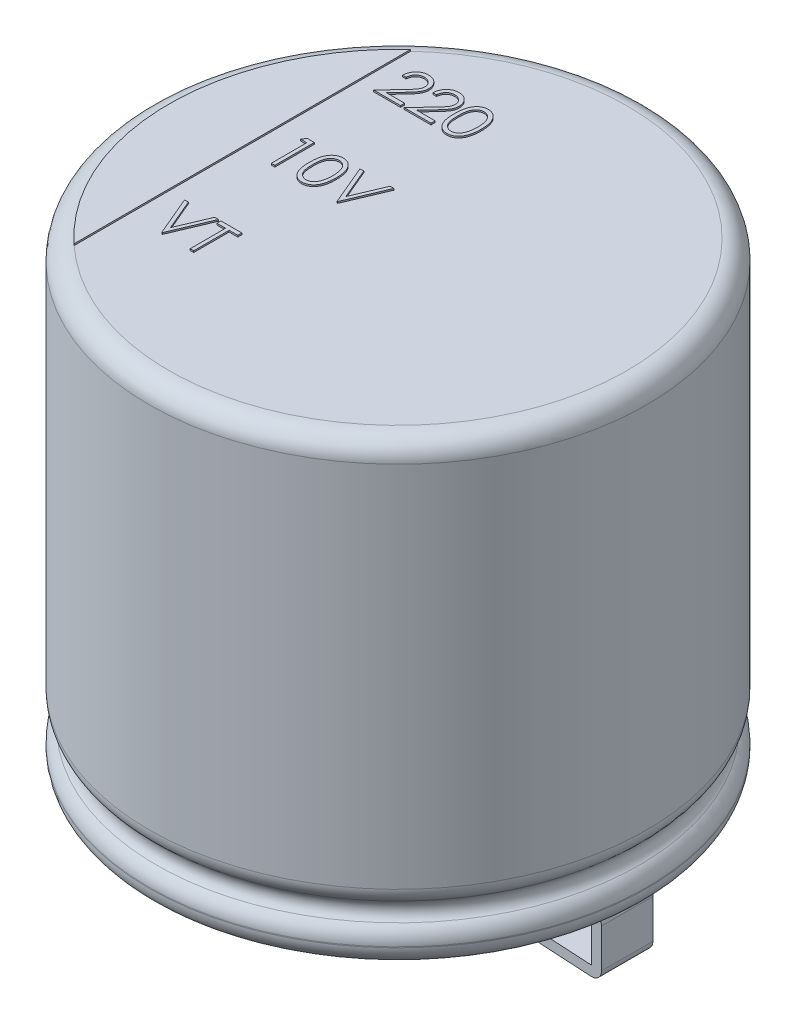
from build123d import *

# Parameters (mm, degrees)
LABELING_START      = 2.9
LABELING_TEXT_DEPTH = 0.02
TAB_DEPTH           = 0.325
TAB_2_DEPTH         = 0.325
CUT_EXTRUDE1_DEPTH  = 8.329215676


# Read off the part's stored shape, not the designer's step: Labeling Text
with BuildPart() as part:
    # Sketch1 → Cap Body (revolve)
    with BuildSketch(Plane(origin=(0, 0, 0), x_dir=(0, 0, -1), z_dir=(1, 0, 0))):
        with BuildLine():
            Line((0, 2.9), (0, -2.9))
            Line((0, -2.9), (2.9, -2.9))
            ThreePointArc((2.9, -2.9), (3.076776695, -2.826776695), (3.15, -2.65))
            Line((3.15, -2.65), (3.15, -2.638280347))
            ThreePointArc((3.15, -2.638280347), (3.125108719, -2.529532636), (3.055391484, -2.442439884))
            ThreePointArc((3.055391484, -2.442439884), (2.997790055, -2.32320442), (3.055391484, -2.203968956))
            ThreePointArc((3.055391484, -2.203968956), (3.125108719, -2.116876204), (3.15, -2.008128493))
            Line((3.15, -2.008128493), (3.15, 2.65))
            ThreePointArc((3.15, 2.65), (3.076776695, 2.826776695), (2.9, 2.9))
            Line((2.9, 2.9), (0, 2.9))
        make_face()
    revolve(axis=Axis((0, -4.584100675, 0), (0, 1, 0)))

    # Labeling Text outline → Labeling Text (add)
    # profile 1 of 9: a face of its own
    with BuildSketch(Plane(origin=(0, 0, 0), x_dir=(1, 0, 0), z_dir=(0, 1, 0)).offset(LABELING_START)):
        with BuildLine():
            add(Edge.make_bspline(
                [(-1.577067817, 1.911538462), (-1.580977936, 1.911436314), (-1.588656764, 1.911235713), (-1.599930912, 1.909832476), (-1.610686023, 1.907411641), (-1.620949152, 1.904100688), (-1.630737664, 1.899892324), (-1.640003956, 1.894650646), (-1.648727226, 1.888395861), (-1.656923872, 1.881304353), (-1.664475869, 1.873408981), (-1.671111137, 1.864607558), (-1.676908853, 1.855060785), (-1.681967315, 1.84479442), (-1.686075271, 1.833715309), (-1.689214293, 1.821862779), (-1.691698128, 1.809288296), (-1.692527916, 1.800604713), (-1.692953234, 1.796153846)],
                knots=[0, 0, 0, 0, 0.064438672, 0.126546911, 0.186887153, 0.245877536, 0.304040885, 0.362191218, 0.420975933, 0.480660283, 0.540600275, 0.600689098, 0.66193579, 0.724442506, 0.789038394, 0.856313757, 0.926352028, 1, 1, 1, 1], degree=3))
            add(Edge.make_bspline(
                [(-1.468594259, 1.810176282), (-1.46868508, 1.81358791), (-1.468864069, 1.820311575), (-1.47044374, 1.83016954), (-1.472830955, 1.839678799), (-1.476251707, 1.848868602), (-1.480766955, 1.857646552), (-1.486263152, 1.866023335), (-1.49260459, 1.874121759), (-1.499940485, 1.881715087), (-1.507999274, 1.888669545), (-1.516512738, 1.894830129), (-1.525519896, 1.899978573), (-1.534982771, 1.904199073), (-1.544874981, 1.907509842), (-1.555215658, 1.909803924), (-1.565976232, 1.911244279), (-1.573323874, 1.911439161), (-1.577067817, 1.911538462)],
                knots=[0, 0, 0, 0, 0.061965401, 0.122121906, 0.180988497, 0.239933216, 0.299905831, 0.359988847, 0.421775742, 0.486575826, 0.551534805, 0.615017543, 0.677258617, 0.739729962, 0.803050103, 0.866495132, 0.931973474, 1, 1, 1, 1], degree=3))
            add(Edge.make_bspline(
                [(-1.563145541, 1.65693109), (-1.558424415, 1.661859419), (-1.549356097, 1.671325732), (-1.536530014, 1.685146154), (-1.525010159, 1.697967517), (-1.51472196, 1.709765596), (-1.505888602, 1.720712963), (-1.498049712, 1.730455063), (-1.491768913, 1.739419985), (-1.484952428, 1.749811501), (-1.47835043, 1.762498975), (-1.472677237, 1.778003788), (-1.469217973, 1.793964824), (-1.468802996, 1.804750829), (-1.468594259, 1.810176282)],
                knots=[0, 0, 0, 0, 0.110802644, 0.212829202, 0.30610131, 0.390647321, 0.466924469, 0.534481039, 0.593586941, 0.644557005, 0.736200453, 0.825024026, 0.911985585, 1, 1, 1, 1], degree=3))
            Line((-1.563145541, 1.65693109), (-1.757055798, 1.45))
            Line((-1.757055798, 1.45), (-1.417312208, 1.45))
            Line((-1.417312208, 1.45), (-1.417312208, 1.501282051))
            Line((-1.417312208, 1.501282051), (-1.649984484, 1.501282051))
            Line((-1.649984484, 1.501282051), (-1.524884324, 1.634795673))
            add(Edge.make_bspline(
                [(-1.423722465, 1.814182692), (-1.423964359, 1.807218716), (-1.424443904, 1.793412971), (-1.428545957, 1.773125134), (-1.434952602, 1.753468931), (-1.44266651, 1.737649316), (-1.450448288, 1.724901674), (-1.457460789, 1.714406145), (-1.465670048, 1.703105364), (-1.475195547, 1.691037173), (-1.485840243, 1.678107043), (-1.497700552, 1.664322787), (-1.51086105, 1.64982682), (-1.520097978, 1.63992602), (-1.524884324, 1.634795673)],
                knots=[0, 0, 0, 0, 0.098702196, 0.195672309, 0.292422427, 0.391342544, 0.444462441, 0.504228775, 0.570352338, 0.642545753, 0.722287505, 0.807921123, 0.900469538, 1, 1, 1, 1], degree=3))
            add(Edge.make_bspline(
                [(-1.574764131, 1.962820513), (-1.569281549, 1.962692162), (-1.558508471, 1.962439957), (-1.542785326, 1.960274096), (-1.527817142, 1.956881868), (-1.513633175, 1.952122523), (-1.500346594, 1.945724748), (-1.487857588, 1.938039385), (-1.476017472, 1.929150838), (-1.46535936, 1.918686007), (-1.455572492, 1.907514238), (-1.447129312, 1.895587395), (-1.43989886, 1.883268925), (-1.433872049, 1.870464896), (-1.429435458, 1.85705475), (-1.426067142, 1.843233721), (-1.424163226, 1.828858748), (-1.423871023, 1.81912924), (-1.423722465, 1.814182692)],
                knots=[0, 0, 0, 0, 0.06947546, 0.136516798, 0.200788824, 0.263829673, 0.325735023, 0.387290692, 0.449509219, 0.51296782, 0.576275215, 0.6375801, 0.697902606, 0.757172088, 0.816598528, 0.876653171, 0.937289642, 1, 1, 1, 1], degree=3))
            add(Edge.make_bspline(
                [(-1.737825029, 1.796153846), (-1.737532578, 1.80210683), (-1.736958213, 1.813798332), (-1.734268458, 1.830844605), (-1.730419761, 1.847138147), (-1.724978125, 1.862548135), (-1.718220085, 1.877210822), (-1.710115795, 1.891067967), (-1.700516674, 1.904066708), (-1.689629998, 1.916086543), (-1.677805906, 1.927113339), (-1.665047915, 1.936635516), (-1.651641482, 1.944680898), (-1.637627283, 1.951406789), (-1.622847202, 1.956455339), (-1.607435365, 1.960201287), (-1.59132406, 1.962455051), (-1.580346914, 1.962697306), (-1.574764131, 1.962820513)],
                knots=[0, 0, 0, 0, 0.068790794, 0.135103289, 0.198978674, 0.2619043, 0.323494969, 0.385195378, 0.446969239, 0.509764777, 0.572250569, 0.633405176, 0.693251163, 0.752583163, 0.812579266, 0.873275085, 0.935549943, 1, 1, 1, 1], degree=3))
            Line((-1.737825029, 1.796153846), (-1.692953234, 1.796153846))
        make_face()
    # profile 2 of 9: a face of its own
    with BuildSketch(Plane(origin=(0, 0, 0), x_dir=(1, 0, 0), z_dir=(0, 1, 0)).offset(LABELING_START)):
        with BuildLine():
            add(Edge.make_bspline(
                [(-1.192452432, 1.911538462), (-1.196362551, 1.911436314), (-1.204041379, 1.911235713), (-1.215315527, 1.909832476), (-1.226070638, 1.907411641), (-1.236333767, 1.904100688), (-1.246122279, 1.899892324), (-1.255388571, 1.894650646), (-1.264111841, 1.888395861), (-1.272308487, 1.881304353), (-1.279860484, 1.873408981), (-1.286495752, 1.864607558), (-1.292293469, 1.855060785), (-1.297351931, 1.84479442), (-1.301459886, 1.833715309), (-1.304598908, 1.821862779), (-1.307082743, 1.809288296), (-1.307912532, 1.800604713), (-1.308337849, 1.796153846)],
                knots=[0, 0, 0, 0, 0.064438672, 0.126546911, 0.186887153, 0.245877536, 0.304040885, 0.362191218, 0.420975933, 0.480660283, 0.540600275, 0.600689098, 0.66193579, 0.724442506, 0.789038394, 0.856313757, 0.926352028, 1, 1, 1, 1], degree=3))
            add(Edge.make_bspline(
                [(-1.083978875, 1.810176282), (-1.084069695, 1.81358791), (-1.084248685, 1.820311575), (-1.085828356, 1.83016954), (-1.088215571, 1.839678799), (-1.091636322, 1.848868602), (-1.096151571, 1.857646552), (-1.101647768, 1.866023335), (-1.107989205, 1.874121759), (-1.115325101, 1.881715087), (-1.123383889, 1.888669545), (-1.131897354, 1.894830129), (-1.140904511, 1.899978573), (-1.150367386, 1.904199073), (-1.160259596, 1.907509842), (-1.170600274, 1.909803924), (-1.181360848, 1.911244279), (-1.18870849, 1.911439161), (-1.192452432, 1.911538462)],
                knots=[0, 0, 0, 0, 0.061965401, 0.122121906, 0.180988497, 0.239933216, 0.299905831, 0.359988847, 0.421775742, 0.486575826, 0.551534805, 0.615017543, 0.677258617, 0.739729962, 0.803050103, 0.866495132, 0.931973474, 1, 1, 1, 1], degree=3))
            add(Edge.make_bspline(
                [(-1.178530157, 1.65693109), (-1.17380903, 1.661859419), (-1.164740712, 1.671325732), (-1.15191463, 1.685146154), (-1.140394774, 1.697967517), (-1.130106575, 1.709765596), (-1.121273217, 1.720712963), (-1.113434327, 1.730455063), (-1.107153528, 1.739419985), (-1.100337043, 1.749811501), (-1.093735046, 1.762498975), (-1.088061852, 1.778003788), (-1.084602588, 1.793964824), (-1.084187612, 1.804750829), (-1.083978875, 1.810176282)],
                knots=[0, 0, 0, 0, 0.110802644, 0.212829202, 0.30610131, 0.390647321, 0.466924469, 0.534481039, 0.593586941, 0.644557005, 0.736200453, 0.825024026, 0.911985585, 1, 1, 1, 1], degree=3))
            Line((-1.178530157, 1.65693109), (-1.372440413, 1.45))
            Line((-1.372440413, 1.45), (-1.032696824, 1.45))
            Line((-1.032696824, 1.45), (-1.032696824, 1.501282051))
            Line((-1.032696824, 1.501282051), (-1.265369099, 1.501282051))
            Line((-1.265369099, 1.501282051), (-1.140268939, 1.634795673))
            add(Edge.make_bspline(
                [(-1.03910708, 1.814182692), (-1.039348975, 1.807218716), (-1.039828519, 1.793412971), (-1.043930573, 1.773125134), (-1.050337217, 1.753468931), (-1.058051125, 1.737649316), (-1.065832903, 1.724901674), (-1.072845404, 1.714406145), (-1.081054663, 1.703105364), (-1.090580163, 1.691037173), (-1.101224859, 1.678107043), (-1.113085168, 1.664322787), (-1.126245665, 1.64982682), (-1.135482594, 1.63992602), (-1.140268939, 1.634795673)],
                knots=[0, 0, 0, 0, 0.098702196, 0.195672309, 0.292422427, 0.391342544, 0.444462441, 0.504228775, 0.570352338, 0.642545753, 0.722287505, 0.807921123, 0.900469538, 1, 1, 1, 1], degree=3))
            add(Edge.make_bspline(
                [(-1.190148747, 1.962820513), (-1.184666165, 1.962692162), (-1.173893087, 1.962439957), (-1.158169942, 1.960274096), (-1.143201757, 1.956881868), (-1.12901779, 1.952122523), (-1.11573121, 1.945724748), (-1.103242203, 1.938039385), (-1.091402087, 1.929150838), (-1.080743975, 1.918686007), (-1.070957107, 1.907514238), (-1.062513928, 1.895587395), (-1.055283476, 1.883268925), (-1.049256664, 1.870464896), (-1.044820073, 1.85705475), (-1.041451758, 1.843233721), (-1.039547841, 1.828858748), (-1.039255638, 1.81912924), (-1.03910708, 1.814182692)],
                knots=[0, 0, 0, 0, 0.06947546, 0.136516798, 0.200788824, 0.263829673, 0.325735023, 0.387290692, 0.449509219, 0.51296782, 0.576275215, 0.6375801, 0.697902606, 0.757172088, 0.816598528, 0.876653171, 0.937289642, 1, 1, 1, 1], degree=3))
            add(Edge.make_bspline(
                [(-1.353209644, 1.796153846), (-1.352917194, 1.80210683), (-1.352342829, 1.813798332), (-1.349653073, 1.830844605), (-1.345804376, 1.847138147), (-1.34036274, 1.862548135), (-1.3336047, 1.877210822), (-1.325500411, 1.891067967), (-1.315901289, 1.904066708), (-1.305014613, 1.916086543), (-1.293190522, 1.927113339), (-1.28043253, 1.936635516), (-1.267026098, 1.944680898), (-1.253011898, 1.951406789), (-1.238231818, 1.956455339), (-1.222819981, 1.960201287), (-1.206708675, 1.962455051), (-1.195731529, 1.962697306), (-1.190148747, 1.962820513)],
                knots=[0, 0, 0, 0, 0.068790794, 0.135103289, 0.198978674, 0.2619043, 0.323494969, 0.385195378, 0.446969239, 0.509764777, 0.572250569, 0.633405176, 0.693251163, 0.752583163, 0.812579266, 0.873275085, 0.935549943, 1, 1, 1, 1], degree=3))
            Line((-1.353209644, 1.796153846), (-1.308337849, 1.796153846))
        make_face()
    # profile 3 of 9: a face of its own
    with BuildSketch(Plane(origin=(0, 0, 0), x_dir=(1, 0, 0), z_dir=(0, 1, 0)).offset(LABELING_START)):
        with BuildLine():
            add(Edge.make_bspline(
                [(-0.820657561, 1.437179487), (-0.824601006, 1.437246109), (-0.832376709, 1.437377475), (-0.843898484, 1.43873658), (-0.85508169, 1.440921652), (-0.865981512, 1.443981167), (-0.876653872, 1.447726143), (-0.886953341, 1.452605241), (-0.896994439, 1.458224394), (-0.906750375, 1.46462374), (-0.916037827, 1.471955409), (-0.924909056, 1.480064593), (-0.933141202, 1.489153651), (-0.940803216, 1.499079069), (-0.948085228, 1.509749532), (-0.95478371, 1.521310728), (-0.960979546, 1.533716816), (-0.966642902, 1.547047946), (-0.97166414, 1.56149865), (-0.976099527, 1.577234247), (-0.979601549, 1.594393623), (-0.982599114, 1.612838961), (-0.985016883, 1.632649523), (-0.986667501, 1.653836063), (-0.987687689, 1.676385378), (-0.987778413, 1.691852489), (-0.987825029, 1.699799679)],
                knots=[0, 0, 0, 0, 0.033787146, 0.066621658, 0.099284878, 0.131361165, 0.163585188, 0.196103927, 0.228902254, 0.262158056, 0.295991222, 0.330217846, 0.365059826, 0.400950737, 0.437620382, 0.475707529, 0.515380692, 0.556413541, 0.59976483, 0.646424156, 0.696431445, 0.749781518, 0.806573307, 0.867435532, 0.931886753, 1, 1, 1, 1], degree=3))
            add(Edge.make_bspline(
                [(-0.648081439, 1.699799679), (-0.648174522, 1.692153407), (-0.648355892, 1.677254957), (-0.649295707, 1.655464817), (-0.65114694, 1.634893668), (-0.653462653, 1.615492174), (-0.656669933, 1.597341085), (-0.660613528, 1.580377593), (-0.664992146, 1.56452844), (-0.670397116, 1.549923466), (-0.676312932, 1.536358935), (-0.682749389, 1.523692199), (-0.689645078, 1.5118113), (-0.697157756, 1.500811336), (-0.705165387, 1.490614385), (-0.713839356, 1.481400439), (-0.722935154, 1.472947486), (-0.732565499, 1.465425825), (-0.742624292, 1.458842281), (-0.752904161, 1.452954589), (-0.763587501, 1.448207061), (-0.774432209, 1.444130626), (-0.785593404, 1.441016276), (-0.797057174, 1.438862868), (-0.808765208, 1.437352604), (-0.816679717, 1.437237393), (-0.820657561, 1.437179487)],
                knots=[0, 0, 0, 0, 0.06506329, 0.126773166, 0.185515763, 0.240764679, 0.292979796, 0.342250373, 0.388919286, 0.432775664, 0.474628433, 0.514774691, 0.553605893, 0.591426406, 0.62802812, 0.663803634, 0.698984336, 0.733591489, 0.767628469, 0.801208348, 0.83426384, 0.866980695, 0.899719742, 0.932701912, 0.966175883, 1, 1, 1, 1], degree=3))
            add(Edge.make_bspline(
                [(-0.820657561, 1.962820513), (-0.816681064, 1.962750825), (-0.808773062, 1.962612238), (-0.79708158, 1.961280246), (-0.785660197, 1.959070085), (-0.774557606, 1.955938518), (-0.763682608, 1.952053421), (-0.753120264, 1.947183833), (-0.742804967, 1.941515423), (-0.73290064, 1.934854869), (-0.723298552, 1.92742883), (-0.714234557, 1.919034163), (-0.705707831, 1.909755632), (-0.697611358, 1.899692508), (-0.690174845, 1.888651782), (-0.683092926, 1.87682548), (-0.676754063, 1.864006785), (-0.67064911, 1.850409576), (-0.66537954, 1.835657624), (-0.660627219, 1.819834087), (-0.656787367, 1.80275206), (-0.653588899, 1.784501168), (-0.651111057, 1.765014385), (-0.649306394, 1.744333483), (-0.648353096, 1.722444856), (-0.648173567, 1.707479449), (-0.648081439, 1.699799679)],
                knots=[0, 0, 0, 0, 0.033788116, 0.067193932, 0.099862411, 0.132566612, 0.165151173, 0.197913187, 0.231319004, 0.265083278, 0.299255309, 0.334398567, 0.369942824, 0.406283561, 0.44406382, 0.482997707, 0.523354447, 0.56553659, 0.609612924, 0.656390811, 0.705885495, 0.7583245, 0.813831783, 0.872794559, 0.93472223, 1, 1, 1, 1], degree=3))
            add(Edge.make_bspline(
                [(-0.987825029, 1.699799679), (-0.987778169, 1.707813592), (-0.987687143, 1.723380733), (-0.986674512, 1.746064253), (-0.98499232, 1.767344294), (-0.982686981, 1.787221875), (-0.979881555, 1.805702127), (-0.976136486, 1.822735664), (-0.971877514, 1.838401322), (-0.96694145, 1.852750186), (-0.961371766, 1.865975572), (-0.955309729, 1.87832203), (-0.948514758, 1.889770877), (-0.941375199, 1.900504847), (-0.933602046, 1.910348232), (-0.925416505, 1.919440041), (-0.916499094, 1.927570148), (-0.90715295, 1.934976763), (-0.897293455, 1.941469544), (-0.887201645, 1.947188507), (-0.876808059, 1.952074202), (-0.866084318, 1.955915693), (-0.85512681, 1.959088671), (-0.843897229, 1.961258521), (-0.832377034, 1.962623794), (-0.824601115, 1.962754318), (-0.820657561, 1.962820513)],
                knots=[0, 0, 0, 0, 0.068594622, 0.133246042, 0.194312586, 0.251279223, 0.304513439, 0.354234907, 0.400480589, 0.443410755, 0.484014869, 0.523252301, 0.561042373, 0.597900239, 0.633518489, 0.668314351, 0.702495671, 0.736685354, 0.770293169, 0.803437255, 0.835912952, 0.868460246, 0.900846538, 0.933466525, 0.966257575, 1, 1, 1, 1], degree=3))
        make_face()
        with BuildLine():
            add(Edge.make_bspline(
                [(-0.819155157, 1.911538462), (-0.824685241, 1.911248255), (-0.835755485, 1.910667313), (-0.852105193, 1.906568277), (-0.867777243, 1.899423567), (-0.880240525, 1.891573228), (-0.889792495, 1.884096327), (-0.896518594, 1.877612548), (-0.90282519, 1.870520225), (-0.908634861, 1.862748523), (-0.914076187, 1.854396328), (-0.919073475, 1.845397933), (-0.923575951, 1.835707738), (-0.927730884, 1.825333962), (-0.93138414, 1.813965255), (-0.934397563, 1.801426828), (-0.937181428, 1.787646557), (-0.939152181, 1.772543771), (-0.940904146, 1.756217749), (-0.942030052, 1.738606703), (-0.942905946, 1.719740363), (-0.942937156, 1.706711912), (-0.942953234, 1.7)],
                knots=[0, 0, 0, 0, 0.060386619, 0.120883249, 0.182754619, 0.24781103, 0.2812991, 0.315087624, 0.349702396, 0.384856581, 0.420966197, 0.458511188, 0.497174722, 0.537602048, 0.580503018, 0.62746754, 0.67838821, 0.733983221, 0.793746705, 0.857713672, 0.926697864, 1, 1, 1, 1], degree=3))
            add(Edge.make_bspline(
                [(-0.692953234, 1.7), (-0.693031832, 1.706009653), (-0.693185588, 1.71776582), (-0.6937733, 1.734982703), (-0.695290954, 1.75133524), (-0.696976542, 1.766893879), (-0.699461859, 1.781572493), (-0.702141546, 1.795493966), (-0.705741719, 1.808485826), (-0.709587401, 1.820751481), (-0.713988886, 1.832151574), (-0.718833991, 1.842739258), (-0.724008528, 1.852565647), (-0.729628848, 1.861603782), (-0.735628232, 1.869894145), (-0.742165024, 1.877270516), (-0.748979935, 1.883961511), (-0.758525247, 1.891599021), (-0.771021574, 1.899386406), (-0.786570952, 1.906552943), (-0.802752473, 1.910668414), (-0.813691538, 1.911248655), (-0.819155157, 1.911538462)],
                knots=[0, 0, 0, 0, 0.065681198, 0.128486464, 0.18817513, 0.245106131, 0.299448425, 0.350822936, 0.399941681, 0.446671744, 0.491254533, 0.533376344, 0.573852755, 0.612526312, 0.649597136, 0.685532042, 0.720105786, 0.753837663, 0.818925416, 0.880493462, 0.940311334, 1, 1, 1, 1], degree=3))
            add(Edge.make_bspline(
                [(-0.711883522, 1.574298878), (-0.710376127, 1.57876027), (-0.707315468, 1.587818807), (-0.703370929, 1.601870758), (-0.700264443, 1.61661401), (-0.697469676, 1.631960455), (-0.695562097, 1.648023269), (-0.694026695, 1.664752753), (-0.693122311, 1.682161519), (-0.693010204, 1.693989375), (-0.692953234, 1.7)],
                knots=[0, 0, 0, 0, 0.110588339, 0.224541754, 0.342503494, 0.464324098, 0.590756033, 0.722227475, 0.858842836, 1, 1, 1, 1], degree=3))
            add(Edge.make_bspline(
                [(-0.819155157, 1.488461538), (-0.813618347, 1.488689793), (-0.802556158, 1.48914583), (-0.786394187, 1.49354565), (-0.770704148, 1.500184156), (-0.758408157, 1.508033799), (-0.749053508, 1.515509275), (-0.742351081, 1.521882796), (-0.736199359, 1.529019349), (-0.730364777, 1.536719248), (-0.725013481, 1.545129603), (-0.720147318, 1.554209971), (-0.71570684, 1.563985568), (-0.713176976, 1.570809816), (-0.711883522, 1.574298878)],
                knots=[0, 0, 0, 0, 0.112813401, 0.225393884, 0.339594815, 0.45967541, 0.52173519, 0.583925839, 0.648174145, 0.713881038, 0.781004455, 0.851450928, 0.924050693, 1, 1, 1, 1], degree=3))
            add(Edge.make_bspline(
                [(-0.942953234, 1.7), (-0.94293617, 1.693321614), (-0.942903052, 1.680360179), (-0.942037881, 1.661525428), (-0.940859276, 1.643958238), (-0.939339091, 1.627636304), (-0.937081527, 1.612614874), (-0.934551986, 1.598790634), (-0.931473687, 1.586236742), (-0.927831542, 1.574867055), (-0.923683099, 1.564488617), (-0.91915369, 1.5548313), (-0.914287873, 1.545781024), (-0.90884228, 1.53741908), (-0.902911556, 1.529718199), (-0.896629662, 1.52254208), (-0.88976215, 1.516142512), (-0.880261616, 1.508467247), (-0.867719262, 1.500535942), (-0.85191634, 1.493629357), (-0.83567799, 1.489289007), (-0.824656383, 1.488737041), (-0.819155157, 1.488461538)],
                knots=[0, 0, 0, 0, 0.072951066, 0.141583694, 0.20592646, 0.265301357, 0.320597233, 0.371816503, 0.41878977, 0.461698729, 0.502133582, 0.540804315, 0.578180525, 0.614296865, 0.649678243, 0.68429946, 0.718358953, 0.752080865, 0.817652439, 0.879722076, 0.93996556, 1, 1, 1, 1], degree=3))
        make_face(mode=Mode.SUBTRACT)
    # profile 4 of 9: a face of its own
    with BuildSketch(Plane(origin=(0, 0, 0), x_dir=(1, 0, 0), z_dir=(0, 1, 0)).offset(LABELING_START)):
        with BuildLine():
            add(Edge.make_bspline(
                [(-1.205272945, -0.012820513), (-1.20921639, -0.012753891), (-1.216992094, -0.012622525), (-1.228513869, -0.01126342), (-1.239697075, -0.009078348), (-1.250596897, -0.006018833), (-1.261269256, -0.002273857), (-1.271568726, 0.002605241), (-1.281609823, 0.008224394), (-1.29136576, 0.01462374), (-1.300653212, 0.021955409), (-1.309524441, 0.030064593), (-1.317756587, 0.039153651), (-1.3254186, 0.049079069), (-1.332700613, 0.059749532), (-1.339399095, 0.071310728), (-1.345594931, 0.083716816), (-1.351258287, 0.097047946), (-1.356279524, 0.11149865), (-1.360714911, 0.127234247), (-1.364216934, 0.144393623), (-1.367214499, 0.162838961), (-1.369632268, 0.182649523), (-1.371282886, 0.203836063), (-1.372303074, 0.226385378), (-1.372393798, 0.241852489), (-1.372440413, 0.249799679)],
                knots=[0, 0, 0, 0, 0.033787146, 0.066621658, 0.099284878, 0.131361165, 0.163585188, 0.196103927, 0.228902254, 0.262158056, 0.295991222, 0.330217846, 0.365059826, 0.400950737, 0.437620382, 0.475707529, 0.515380692, 0.556413541, 0.59976483, 0.646424156, 0.696431445, 0.749781518, 0.806573307, 0.867435532, 0.931886753, 1, 1, 1, 1], degree=3))
            add(Edge.make_bspline(
                [(-1.032696824, 0.249799679), (-1.032789907, 0.242153407), (-1.032971276, 0.227254957), (-1.033911092, 0.205464817), (-1.035762325, 0.184893668), (-1.038078037, 0.165492174), (-1.041285318, 0.147341085), (-1.045228913, 0.130377593), (-1.04960753, 0.11452844), (-1.055012501, 0.099923466), (-1.060928317, 0.086358935), (-1.067364773, 0.073692199), (-1.074260463, 0.0618113), (-1.081773141, 0.050811336), (-1.089780771, 0.040614385), (-1.098454741, 0.031400439), (-1.107550539, 0.022947486), (-1.117180884, 0.015425825), (-1.127239677, 0.008842281), (-1.137519545, 0.002954589), (-1.148202886, -0.001792939), (-1.159047593, -0.005869374), (-1.170208788, -0.008983724), (-1.181672558, -0.011137132), (-1.193380592, -0.012647396), (-1.201295101, -0.012762607), (-1.205272945, -0.012820513)],
                knots=[0, 0, 0, 0, 0.06506329, 0.126773166, 0.185515763, 0.240764679, 0.292979796, 0.342250373, 0.388919286, 0.432775664, 0.474628433, 0.514774691, 0.553605893, 0.591426406, 0.62802812, 0.663803634, 0.698984336, 0.733591489, 0.767628469, 0.801208348, 0.83426384, 0.866980695, 0.899719742, 0.932701912, 0.966175883, 1, 1, 1, 1], degree=3))
            add(Edge.make_bspline(
                [(-1.205272945, 0.512820513), (-1.201296448, 0.512750825), (-1.193388447, 0.512612238), (-1.181696965, 0.511280246), (-1.170275582, 0.509070085), (-1.159172991, 0.505938518), (-1.148297993, 0.502053421), (-1.137735649, 0.497183833), (-1.127420351, 0.491515423), (-1.117516024, 0.484854869), (-1.107913936, 0.47742883), (-1.098849942, 0.469034163), (-1.090323215, 0.459755632), (-1.082226743, 0.449692508), (-1.074790229, 0.438651782), (-1.06770831, 0.42682548), (-1.061369448, 0.414006785), (-1.055264494, 0.400409576), (-1.049994925, 0.385657624), (-1.045242604, 0.369834087), (-1.041402751, 0.35275206), (-1.038204284, 0.334501168), (-1.035726442, 0.315014385), (-1.033921779, 0.294333483), (-1.032968481, 0.272444856), (-1.032788952, 0.257479449), (-1.032696824, 0.249799679)],
                knots=[0, 0, 0, 0, 0.033788116, 0.067193932, 0.099862411, 0.132566612, 0.165151173, 0.197913187, 0.231319004, 0.265083278, 0.299255309, 0.334398567, 0.369942824, 0.406283561, 0.44406382, 0.482997707, 0.523354447, 0.56553659, 0.609612924, 0.656390811, 0.705885495, 0.7583245, 0.813831783, 0.872794559, 0.93472223, 1, 1, 1, 1], degree=3))
            add(Edge.make_bspline(
                [(-1.372440413, 0.249799679), (-1.372393554, 0.257813592), (-1.372302528, 0.273380733), (-1.371289896, 0.296064253), (-1.369607704, 0.317344294), (-1.367302365, 0.337221875), (-1.36449694, 0.355702127), (-1.36075187, 0.372735664), (-1.356492898, 0.388401322), (-1.351556835, 0.402750186), (-1.345987151, 0.415975572), (-1.339925113, 0.42832203), (-1.333130143, 0.439770877), (-1.325990584, 0.450504847), (-1.318217431, 0.460348232), (-1.310031889, 0.469440041), (-1.301114478, 0.477570148), (-1.291768334, 0.484976763), (-1.281908839, 0.491469544), (-1.27181703, 0.497188507), (-1.261423443, 0.502074202), (-1.250699703, 0.505915693), (-1.239742195, 0.509088671), (-1.228512614, 0.511258521), (-1.216992419, 0.512623794), (-1.2092165, 0.512754318), (-1.205272945, 0.512820513)],
                knots=[0, 0, 0, 0, 0.068594622, 0.133246042, 0.194312586, 0.251279223, 0.304513439, 0.354234907, 0.400480589, 0.443410755, 0.484014869, 0.523252301, 0.561042373, 0.597900239, 0.633518489, 0.668314351, 0.702495671, 0.736685354, 0.770293169, 0.803437255, 0.835912952, 0.868460246, 0.900846538, 0.933466525, 0.966257575, 1, 1, 1, 1], degree=3))
        make_face()
        with BuildLine():
            add(Edge.make_bspline(
                [(-1.203770541, 0.461538462), (-1.209300626, 0.461248255), (-1.22037087, 0.460667313), (-1.236720578, 0.456568277), (-1.252392628, 0.449423567), (-1.26485591, 0.441573228), (-1.274407879, 0.434096327), (-1.281133978, 0.427612548), (-1.287440574, 0.420520225), (-1.293250246, 0.412748523), (-1.298691572, 0.404396328), (-1.30368886, 0.395397933), (-1.308191335, 0.385707738), (-1.312346269, 0.375333962), (-1.315999524, 0.363965255), (-1.319012948, 0.351426828), (-1.321796812, 0.337646557), (-1.323767565, 0.322543771), (-1.32551953, 0.306217749), (-1.326645437, 0.288606703), (-1.327521331, 0.269740363), (-1.32755254, 0.256711912), (-1.327568618, 0.25)],
                knots=[0, 0, 0, 0, 0.060386619, 0.120883249, 0.182754619, 0.24781103, 0.2812991, 0.315087624, 0.349702396, 0.384856581, 0.420966197, 0.458511188, 0.497174722, 0.537602048, 0.580503018, 0.62746754, 0.67838821, 0.733983221, 0.793746705, 0.857713672, 0.926697864, 1, 1, 1, 1], degree=3))
            add(Edge.make_bspline(
                [(-1.077568618, 0.25), (-1.077647217, 0.256009653), (-1.077800972, 0.26776582), (-1.078388685, 0.284982703), (-1.079906338, 0.30133524), (-1.081591927, 0.316893879), (-1.084077244, 0.331572493), (-1.086756931, 0.345493966), (-1.090357104, 0.358485826), (-1.094202786, 0.370751481), (-1.098604271, 0.382151574), (-1.103449376, 0.392739258), (-1.108623913, 0.402565647), (-1.114244233, 0.411603782), (-1.120243616, 0.419894145), (-1.126780409, 0.427270516), (-1.133595319, 0.433961511), (-1.143140632, 0.441599021), (-1.155636959, 0.449386406), (-1.171186337, 0.456552943), (-1.187367858, 0.460668414), (-1.198306922, 0.461248655), (-1.203770541, 0.461538462)],
                knots=[0, 0, 0, 0, 0.065681198, 0.128486464, 0.18817513, 0.245106131, 0.299448425, 0.350822936, 0.399941681, 0.446671744, 0.491254533, 0.533376344, 0.573852755, 0.612526312, 0.649597136, 0.685532042, 0.720105786, 0.753837663, 0.818925416, 0.880493462, 0.940311334, 1, 1, 1, 1], degree=3))
            add(Edge.make_bspline(
                [(-1.096498907, 0.124298878), (-1.094991511, 0.12876027), (-1.091930852, 0.137818807), (-1.087986313, 0.151870758), (-1.084879828, 0.16661401), (-1.082085061, 0.181960455), (-1.080177482, 0.198023269), (-1.07864208, 0.214752753), (-1.077737696, 0.232161519), (-1.077625589, 0.243989375), (-1.077568618, 0.25)],
                knots=[0, 0, 0, 0, 0.110588339, 0.224541754, 0.342503494, 0.464324098, 0.590756033, 0.722227475, 0.858842836, 1, 1, 1, 1], degree=3))
            add(Edge.make_bspline(
                [(-1.203770541, 0.038461538), (-1.198233731, 0.038689793), (-1.187171542, 0.03914583), (-1.171009571, 0.04354565), (-1.155319533, 0.050184156), (-1.143023541, 0.058033799), (-1.133668892, 0.065509275), (-1.126966465, 0.071882796), (-1.120814744, 0.079019349), (-1.114980162, 0.086719248), (-1.109628865, 0.095129603), (-1.104762703, 0.104209971), (-1.100322225, 0.113985568), (-1.097792361, 0.120809816), (-1.096498907, 0.124298878)],
                knots=[0, 0, 0, 0, 0.112813401, 0.225393884, 0.339594815, 0.45967541, 0.52173519, 0.583925839, 0.648174145, 0.713881038, 0.781004455, 0.851450928, 0.924050693, 1, 1, 1, 1], degree=3))
            add(Edge.make_bspline(
                [(-1.327568618, 0.25), (-1.327551555, 0.243321614), (-1.327518437, 0.230360179), (-1.326653265, 0.211525428), (-1.325474661, 0.193958238), (-1.323954476, 0.177636304), (-1.321696911, 0.162614874), (-1.31916737, 0.148790634), (-1.316089072, 0.136236742), (-1.312446926, 0.124867055), (-1.308298484, 0.114488617), (-1.303769075, 0.1048313), (-1.298903257, 0.095781024), (-1.293457664, 0.08741908), (-1.287526941, 0.079718199), (-1.281245047, 0.07254208), (-1.274377535, 0.066142512), (-1.264877, 0.058467247), (-1.252334647, 0.050535942), (-1.236531725, 0.043629357), (-1.220293374, 0.039289007), (-1.209271767, 0.038737041), (-1.203770541, 0.038461538)],
                knots=[0, 0, 0, 0, 0.072951066, 0.141583694, 0.20592646, 0.265301357, 0.320597233, 0.371816503, 0.41878977, 0.461698729, 0.502133582, 0.540804315, 0.578180525, 0.614296865, 0.649678243, 0.68429946, 0.718358953, 0.752080865, 0.817652439, 0.879722076, 0.93996556, 1, 1, 1, 1], degree=3))
        make_face(mode=Mode.SUBTRACT)
    # profile 5 of 9: a face of its own
    with BuildSketch(Plane(origin=(0, 0, 0), x_dir=(1, 0, 0), z_dir=(0, 1, 0)).offset(LABELING_START)):
        Polygon((-1.558337849, 0.5), (-1.650785766, 0.5), (-1.680132721, 0.448717949), (-1.603209644, 0.448717949), (-1.603209644, 0), (-1.558337849, 0), align=None)
    # profile 6 of 9: a face of its own
    with BuildSketch(Plane(origin=(0, 0, 0), x_dir=(1, 0, 0), z_dir=(0, 1, 0)).offset(LABELING_START)):
        Polygon((-0.981414772, 0.5), (-0.769876311, 0), (-0.763466054, 0), (-0.551927593, 0.5), (-0.600004516, 0.5), (-0.766671182, 0.105969551), (-0.933337849, 0.5), align=None)
    # profile 7 of 9: a face of its own
    with BuildSketch(Plane(origin=(0, 0, 0), x_dir=(1, 0, 0), z_dir=(0, 1, 0)).offset(LABELING_START)):
        Polygon((-1.702568618, -0.95), (-1.750645541, -0.95), (-1.53910708, -1.45), (-1.532696824, -1.45), (-1.321158362, -0.95), (-1.369235285, -0.95), (-1.535901952, -1.344030449), align=None)
    # profile 8 of 9: a face of its own
    with BuildSketch(Plane(origin=(0, 0, 0), x_dir=(1, 0, 0), z_dir=(0, 1, 0)).offset(LABELING_START)):
        Polygon((-1.180132721, -1.001282051), (-1.180132721, -1.45), (-1.135260926, -1.45), (-1.135260926, -1.001282051), (-1.026286567, -1.001282051), (-1.026286567, -0.95), (-1.28910708, -0.95), (-1.28910708, -1.001282051), align=None)
    # profile 9 of 9: a face of its own
    with BuildSketch(Plane(origin=(0, 0, 0), x_dir=(1, 0, 0), z_dir=(0, 1, 0)).offset(LABELING_START)):
        with BuildLine():
            ThreePointArc((-1.968594259, 2.129468629), (-2.9, 0), (-1.968594259, -2.129468629))
            Line((-1.968594259, -2.129468629), (-1.968594259, 2.129468629))
        make_face()
    extrude(amount=LABELING_TEXT_DEPTH)


with BuildPart() as body_2:
    # Tab Sketch → Tab (new, symmetric)
    with BuildSketch(Plane.XY):
        with BuildLine():
            Line((-0.7875, -2.9), (-2.775, -2.9))
            ThreePointArc((-2.775, -2.9), (-2.863388348, -2.936611652), (-2.9, -3.025))
            Line((-2.9, -3.025), (-2.9, -3.51739175))
            ThreePointArc((-2.9, -3.51739175), (-2.860740484, -3.608350914), (-2.767622888, -3.642173873))
            Line((-2.767622888, -3.642173873), (-0.783811444, -3.524891062))
            ThreePointArc((-0.783811444, -3.524891062), (-0.725108938, -3.458811444), (-0.791188556, -3.400108938))
            Line((-0.791188556, -3.400108938), (-2.775, -3.51739175))
            Line((-2.775, -3.51739175), (-2.775, -3.025))
            Line((-2.775, -3.025), (-0.7875, -3.025))
            ThreePointArc((-0.7875, -3.025), (-0.725, -2.9625), (-0.7875, -2.9))
        make_face()
    extrude(amount=TAB_DEPTH, both=True)


with BuildPart() as body_3:
    # Tab Sketch → Tab 2 (new, symmetric)
    with BuildSketch(Plane.XY):
        with BuildLine():
            Line((0.7875, -2.9), (2.775, -2.9))
            ThreePointArc((2.775, -2.9), (2.863388348, -2.936611652), (2.9, -3.025))
            Line((2.9, -3.025), (2.9, -3.51739175))
            ThreePointArc((2.9, -3.51739175), (2.860740484, -3.608350914), (2.767622888, -3.642173873))
            Line((2.767622888, -3.642173873), (0.783811444, -3.524891062))
            ThreePointArc((0.783811444, -3.524891062), (0.725108938, -3.458811444), (0.791188556, -3.400108938))
            Line((0.791188556, -3.400108938), (2.775, -3.51739175))
            Line((2.775, -3.51739175), (2.775, -3.025))
            Line((2.775, -3.025), (0.7875, -3.025))
            ThreePointArc((0.7875, -3.025), (0.725, -2.9625), (0.7875, -2.9))
        make_face()
    extrude(amount=TAB_2_DEPTH, both=True)


with BuildPart() as cut_extrude1_tool:
    # Sketch4 → Cut-Extrude1 (new, through all)
    with BuildSketch(Plane.XZ.offset(2.9)):
        with BuildLine():
            Line((-1.05, 0.325), (-0.725, 0.325))
            Line((-0.725, 0.325), (0.725, 0.325))
            Line((0.725, 0.325), (1.05, 0.325))
            ThreePointArc((1.05, 0.325), (0.725, 0), (1.05, -0.325))
            Line((1.05, -0.325), (0.725, -0.325))
            Line((0.725, -0.325), (-0.725, -0.325))
            Line((-0.725, -0.325), (-1.05, -0.325))
            ThreePointArc((-1.05, -0.325), (-0.725, 0), (-1.05, 0.325))
        make_face()
    extrude(amount=CUT_EXTRUDE1_DEPTH)


with BuildPart() as body_2_1:
    add(body_2.part)

    # Cut-Extrude1: cut by cut_extrude1_tool
    add(cut_extrude1_tool.part, mode=Mode.SUBTRACT)


with BuildPart() as body_3_1:
    add(body_3.part)

    # Cut-Extrude1: cut by cut_extrude1_tool
    add(cut_extrude1_tool.part, mode=Mode.SUBTRACT)


solid = Compound([part.part, body_2_1.part, body_3_1.part])
